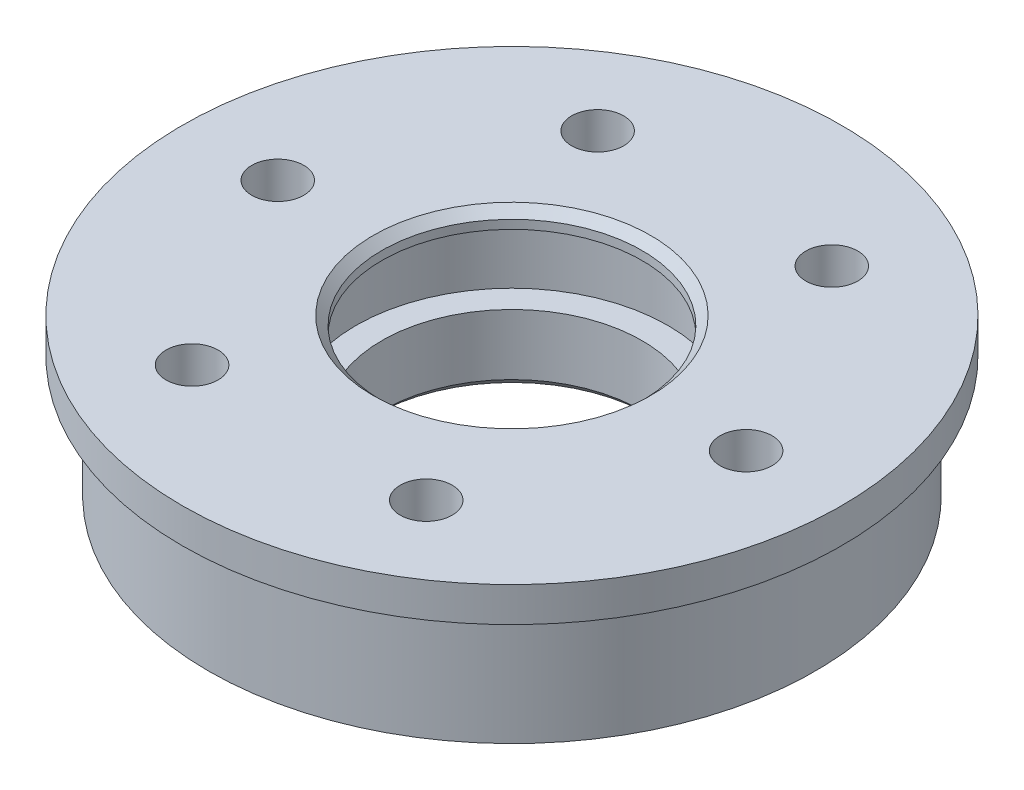
from build123d import *

# Parameters (mm, degrees)
SKETCH1_R           = 17.5
SKETCH1_R_2         = 1.5
SKETCH1_R_3         = 7.5
BOSS_EXTRUDE1_DEPTH = 4.5
CUT_EXTRUDE1_START  = -0.5
SKETCH2_R           = 9
CUT_EXTRUDE1_DEPTH  = 4
SKETCH3_R           = 15
SKETCH3_R_2         = 12
BOSS_EXTRUDE2_DEPTH = 1.5
CHAMFER1_SIZE       = 0.5
SKETCH4_R           = 19
SKETCH4_R_2         = 17.5
BOSS_EXTRUDE3_DEPTH = 2


with BuildPart() as part:
    # Sketch1 → Boss-Extrude1 (new, symmetric)
    with BuildSketch(Plane(origin=(0, 0, 0), x_dir=(1, 0, 0), z_dir=(0, 1, 0))):
        Circle(SKETCH1_R)
        with Locations((13.5, 0)):
            Circle(SKETCH1_R_2, mode=Mode.SUBTRACT)
        with Locations((6.75, -11.691342951)):
            Circle(SKETCH1_R_2, mode=Mode.SUBTRACT)
        with Locations((-6.75, -11.691342951)):
            Circle(SKETCH1_R_2, mode=Mode.SUBTRACT)
        with Locations((-13.5, 0)):
            Circle(SKETCH1_R_2, mode=Mode.SUBTRACT)
        with Locations((-6.75, 11.691342951)):
            Circle(SKETCH1_R_2, mode=Mode.SUBTRACT)
        with Locations((6.75, 11.691342951)):
            Circle(SKETCH1_R_2, mode=Mode.SUBTRACT)
        Circle(SKETCH1_R_3, mode=Mode.SUBTRACT)
    extrude(amount=BOSS_EXTRUDE1_DEPTH, both=True)

    # Sketch2 → Cut-Extrude1 (cut)
    with BuildSketch(Plane(origin=(0, 0, 0), x_dir=(1, 0, 0), z_dir=(0, 1, 0)).offset(CUT_EXTRUDE1_START)):
        Circle(SKETCH2_R)
    extrude(amount=CUT_EXTRUDE1_DEPTH, mode=Mode.SUBTRACT)

    # Sketch3 → Boss-Extrude2 (add)
    with BuildSketch(Plane.XZ.offset(4.5)):
        Circle(SKETCH3_R)
        Circle(SKETCH3_R_2, mode=Mode.SUBTRACT)
    extrude(amount=-BOSS_EXTRUDE2_DEPTH)

    # Chamfer1
    chamfer1_edges = [part.edges().sort_by_distance(p)[0] for p in [
        (-7.5, -4.5, 0),
        (-7.5, 4.5, 0),
    ]]
    chamfer(chamfer1_edges, length=CHAMFER1_SIZE)

    # Sketch4 → Boss-Extrude3 (add)
    with BuildSketch(Plane(origin=(0, 4.5, 0), x_dir=(1, 0, 0), z_dir=(0, 1, 0))):
        Circle(SKETCH4_R)
        Circle(SKETCH4_R_2, mode=Mode.SUBTRACT)
    extrude(amount=-BOSS_EXTRUDE3_DEPTH)


solid = part.part
